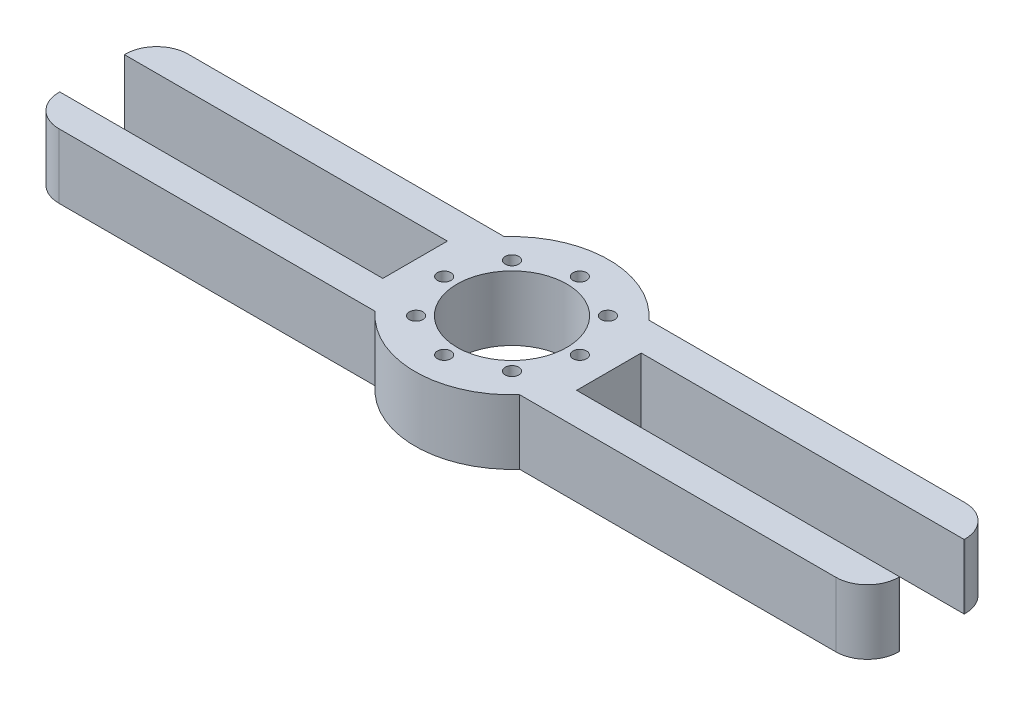
from build123d import *
from build123d.topology import SkipClean

# Parameters (mm, degrees)
BOSS_EXTRUDE1_DEPTH  = 20
SKETCH2_W            = 100
SKETCH2_H            = 20
CUT_EXTRUDE1_DEPTH   = 20
FILLET1_R            = 9.75
FILLET1_OF_MIRROR4_R = 9.75
SKETCH4_R            = 2.1
CUT_EXTRUDE3_DEPTH   = 20


with BuildPart() as part:
    # Sketch1 → Boss-Extrude1 (new body)
    with BuildSketch(Plane(origin=(0, 0, 0), x_dir=(1, 0, 0), z_dir=(0, 1, 0))):
        with BuildLine():
            Line((22.360679775, 20), (130, 20))
            Line((130, 20), (130, -20))
            Line((130, -20), (22.360679775, -20))
            ThreePointArc((22.360679775, -20), (12.247448714, -27.386127875), (0, -30))
            Line((0, -30), (0, -20))
            Line((0, -20), (0, 20))
            Line((0, 20), (0, 30))
            ThreePointArc((0, 30), (12.247448714, 27.386127875), (22.360679775, 20))
        make_face()
    boss_extrude1 = extrude(amount=BOSS_EXTRUDE1_DEPTH)

    # Sketch2 → Cut-Extrude1 (cut)
    with BuildSketch(Plane(origin=(0, 20, 0), x_dir=(1, 0, 0), z_dir=(0, 1, 0))):
        with BuildLine():
            Line((0, 17), (0, -17))
            ThreePointArc((0, -17), (17, 0), (0, 17))
        make_face()
        with Locations((80, 0)):
            Rectangle(SKETCH2_W, SKETCH2_H)
    cut_extrude1 = extrude(amount=-CUT_EXTRUDE1_DEPTH, mode=Mode.SUBTRACT)

    # Fillet1
    fillet1_edges = [part.edges().sort_by_distance(p)[0] for p in [
        (130, 10, -20),
        (130, 10, 20),
    ]]
    fillet(fillet1_edges, radius=FILLET1_R)

    # Mirror4: Boss-Extrude1, Cut-Extrude1 across plane
    with SkipClean():  # the faces are left unmerged after this step: merging them gives an invalid solid
        add(boss_extrude1.mirror(Plane(origin=(0, 0, 0), x_dir=(0, 0, 1), z_dir=(1, 0, 0))))
        add(cut_extrude1.mirror(Plane(origin=(0, 0, 0), x_dir=(0, 0, 1), z_dir=(1, 0, 0))), mode=Mode.SUBTRACT)
    add(part.part.scale(1), mode=Mode.REPLACE)  # the faces are merged on a copy

    # Fillet1 of Mirror4
    fillet1_of_mirror4_edges = [part.edges().sort_by_distance(p)[0] for p in [
        (-130, 10, -20),
        (-130, 10, 20),
    ]]
    fillet(fillet1_of_mirror4_edges, radius=FILLET1_OF_MIRROR4_R)

    # Sketch4 → Cut-Extrude3 (cut)
    with BuildSketch(Plane(origin=(0, 20, 0), x_dir=(1, 0, 0), z_dir=(0, 1, 0))):
        with Locations(Location((21, 0, 0), (0, 0, 270))):
            Circle(SKETCH4_R)
        with Locations(Location((14.849242405, -14.849242405, 0), (0, 0, 270))):
            Circle(SKETCH4_R)
        with Locations(Location((0, -21, 0), (0, 0, 270))):
            Circle(SKETCH4_R)
        with Locations(Location((-14.849242405, -14.849242405, 0), (0, 0, 270))):
            Circle(SKETCH4_R)
        with Locations(Location((-21, 0, 0), (0, 0, 270))):
            Circle(SKETCH4_R)
        with Locations(Location((-14.849242405, 14.849242405, 0), (0, 0, 270))):
            Circle(SKETCH4_R)
        with Locations(Location((0, 21, 0), (0, 0, 270))):
            Circle(SKETCH4_R)
        with Locations(Location((14.849242405, 14.849242405, 0), (0, 0, 270))):
            Circle(SKETCH4_R)
    extrude(amount=-CUT_EXTRUDE3_DEPTH, mode=Mode.SUBTRACT)


solid = part.part
